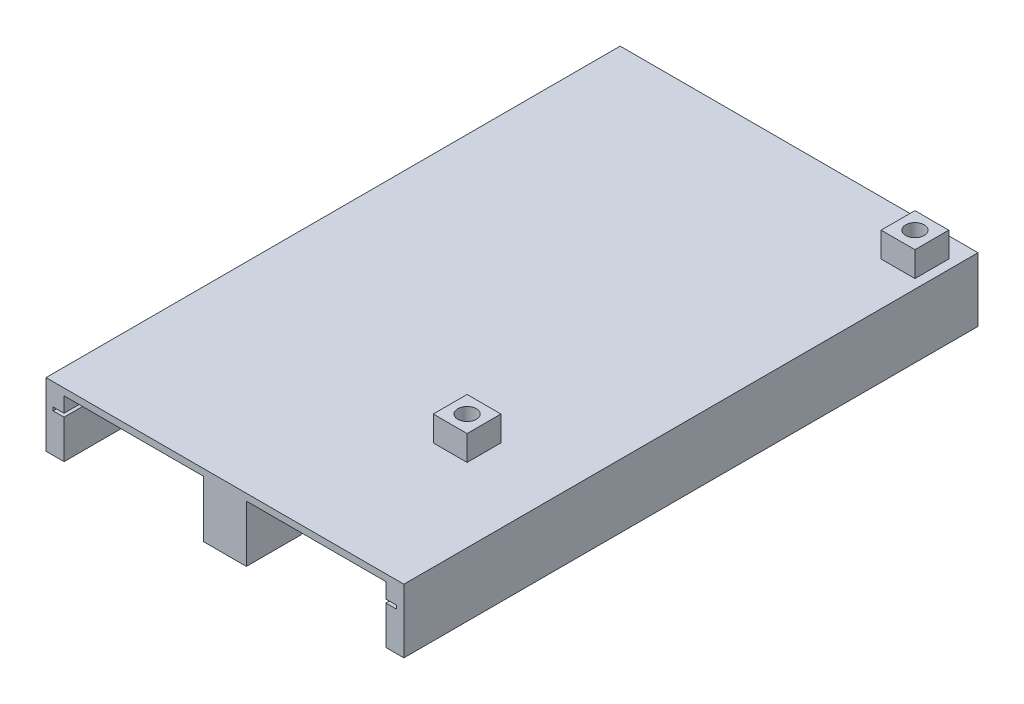
from build123d import *

# Parameters (mm, degrees)
SKETCH_1_W          = 4
SKETCH_1_H          = 127.3
EXTRUDE_1_DEPTH     = 12.65
EXTRUDE_1_2_DEPTH   = 12.65
SKETCH_2_W          = 79.35
SKETCH_2_H          = 127.3
EXTRUDE_2_DEPTH     = 1.5
CUT_EXTRUDE_START   = -1.5
SKETCH_3_W          = 2.4
SKETCH_3_H          = 0.75
CUT_EXTRUDE_1_DEPTH = 133.588098372
SKETCH_4_W          = 71.35
SKETCH_4_H          = 1.5
EXTRUDE_3_DEPTH     = 12.65
SKETCH_6_W          = 7.5
SKETCH_6_H          = 9.8
EXTRUDE_5_DEPTH     = 9.6
SKETCH_7_R          = 2.05
CUT_EXTRUDE_2_DEPTH = 4.5
SKETCH_8_W          = 2.4
SKETCH_8_H          = 5.85
CUT_EXTRUDE_3_DEPTH = 8.55
SKETCH_10_W         = 3
SKETCH_10_H         = 5.95
EXTRUDE_6_DEPTH     = 3.95
SKETCH_11_W         = 40.5
SKETCH_11_H         = 5.95
EXTRUDE_7_DEPTH     = 0.35
FILLET_4_R          = 4
FILLET_5_R          = 2
SKETCH_12_W         = 41
SKETCH_12_H         = 4.65
CUT_EXTRUDE_4_DEPTH = 133.664871481
EXTRUDE_8_DEPTH     = 12.55
SKETCH_14_R         = 2.05
CUT_EXTRUDE_5_DEPTH = 7
SKETCH_15_W         = 7.5
SKETCH_15_H         = 7.5
EXTRUDE_9_DEPTH     = 5.55
SKETCH_16_R         = 2.05
CUT_EXTRUDE_6_DEPTH = 5


with BuildPart() as part:
    # Эскиз1 → Бобышка-Вытянуть1 (new body)
    with BuildSketch(Plane(origin=(0, 0, 0), x_dir=(1, 0, 0), z_dir=(0, 1, 0))):
        with Locations((37.675, 0)):
            Rectangle(SKETCH_1_W, SKETCH_1_H)
    extrude(amount=EXTRUDE_1_DEPTH)



with BuildPart() as body_2:
    # Эскиз1 → Extrude 1 2 (new body)
    with BuildSketch(Plane(origin=(0, 0, 0), x_dir=(1, 0, 0), z_dir=(0, 1, 0))):
        with Locations((-37.675, 0)):
            Rectangle(SKETCH_1_W, SKETCH_1_H)
    extrude(amount=EXTRUDE_1_2_DEPTH)


with BuildPart() as part_1:
    add(part.part)

    add(body_2.part)  # Бобышка-Вытянуть2 merges body 2
    # Эскиз2 → Бобышка-Вытянуть2 (add)
    with BuildSketch(Plane(origin=(0, 12.65, 0), x_dir=(1, 0, 0), z_dir=(0, 1, 0))):
        Rectangle(SKETCH_2_W, SKETCH_2_H)
    extrude(amount=EXTRUDE_2_DEPTH)

    # Эскиз3 → Вырез-Вытянуть1 (cut, through all)
    with BuildSketch(Plane(origin=(0, 0, -63.65), x_dir=(-1, 0, 0), z_dir=(0, 0, -1)).offset(CUT_EXTRUDE_START)):
        with Locations((-36.875, 8.925)):
            Rectangle(SKETCH_3_W, SKETCH_3_H)
        with Locations((36.875, 8.925)):
            Rectangle(SKETCH_3_W, SKETCH_3_H)
    extrude(amount=-CUT_EXTRUDE_1_DEPTH, mode=Mode.SUBTRACT)

    # Эскиз4 → Бобышка-Вытянуть3 (add)
    with BuildSketch(Plane.XZ.offset(-12.65)):
        with Locations((0, -62.9)):
            Rectangle(SKETCH_4_W, SKETCH_4_H)
    extrude(amount=EXTRUDE_3_DEPTH)

    # Эскиз6 → Бобышка-Вытянуть5 (add)
    with BuildSketch(Plane.XZ.offset(-12.65)):
        with Locations((28.575, -57.25)):
            Rectangle(SKETCH_6_W, SKETCH_6_H)
    extrude(amount=EXTRUDE_5_DEPTH)

    # Эскиз7 → Вырез-Вытянуть2 (cut)
    with BuildSketch(Plane.XZ.offset(-3.05)):
        with Locations(Location((28.575, -56.1, 0), (0, 0, 270))):
            Circle(SKETCH_7_R)
    extrude(amount=-CUT_EXTRUDE_2_DEPTH, mode=Mode.SUBTRACT)

    # Эскиз8 → Вырез-Вытянуть3 (cut)
    with BuildSketch(Plane.XZ):
        with Locations((-36.875, 35.125)):
            Rectangle(SKETCH_8_W, SKETCH_8_H)
        with Locations((-36.875, -19.475)):
            Rectangle(SKETCH_8_W, SKETCH_8_H)
        with Locations((36.875, -19.475)):
            Rectangle(SKETCH_8_W, SKETCH_8_H)
        with Locations((36.875, 35.125)):
            Rectangle(SKETCH_8_W, SKETCH_8_H)
    extrude(amount=-CUT_EXTRUDE_3_DEPTH, mode=Mode.SUBTRACT)

    # Эскиз10 → Бобышка-Вытянуть6 (add)
    with BuildSketch(Plane.XZ.offset(-12.65)):
        with Locations((-26.775, -54.725)):
            Rectangle(SKETCH_10_W, SKETCH_10_H)
        with Locations((16.725, -54.725)):
            Rectangle(SKETCH_10_W, SKETCH_10_H)
    extrude(amount=EXTRUDE_6_DEPTH)

    # Эскиз11 → Бобышка-Вытянуть7 (add)
    with BuildSketch(Plane.XZ.offset(-12.65)):
        with Locations((-5.025, -54.725)):
            Rectangle(SKETCH_11_W, SKETCH_11_H)
    extrude(amount=EXTRUDE_7_DEPTH)

    # Скругление4
    # the kernel refuses this fillet: 4 mm, written as the material it adds along each edge
    with BuildSketch(Plane(origin=(18.225, 12.65, -57.7), x_dir=(0, 0, -1), z_dir=(-1, 0, 0))) as fillet_4_piece_1_section:
        with BuildLine():
            CenterArc((FILLET_4_R, FILLET_4_R), FILLET_4_R, 180, 90)
            Line((0, FILLET_4_R), (0, 0))
            Line((0, 0), (FILLET_4_R, 0))
        make_face()
    fillet_4_piece_1 = extrude(amount=46.5, mode=Mode.PRIVATE)
    fillet_4_piece_1 = split(fillet_4_piece_1, bisect_by=Plane(origin=(15.225, 12.535953676, -59.259664423), z_dir=(1, 0, 0)), keep=Keep.TOP, mode=Mode.PRIVATE)
    fillet_4_piece_1 = split(fillet_4_piece_1, bisect_by=Plane(origin=(16.725, 12.3, -59.259664423), z_dir=(0, 1, 0)), keep=Keep.TOP, mode=Mode.PRIVATE)
    add(fillet_4_piece_1)
    with BuildSketch(Plane(origin=(18.225, 12.65, -57.7), x_dir=(0, 0, -1), z_dir=(-1, 0, 0))) as fillet_4_piece_2_section:
        with BuildLine():
            CenterArc((FILLET_4_R, FILLET_4_R), FILLET_4_R, 180, 90)
            Line((0, FILLET_4_R), (0, 0))
            Line((0, 0), (FILLET_4_R, 0))
        make_face()
    fillet_4_piece_2 = extrude(amount=46.5, mode=Mode.PRIVATE)
    fillet_4_piece_2 = split(fillet_4_piece_2, bisect_by=Plane(origin=(16.725, 8.7, -58.276150153), z_dir=(0, 1, 0)), keep=Keep.TOP, mode=Mode.PRIVATE)
    fillet_4_piece_2 = split(fillet_4_piece_2, bisect_by=Plane(origin=(15.225, 11.348610823, -58.276150153), z_dir=(1, 0, 0)), keep=Keep.TOP, mode=Mode.PRIVATE)
    fillet_4_piece_2 = split(fillet_4_piece_2, bisect_by=Plane(origin=(16.725, 12.3, -58.276150153), z_dir=(0, -1, 0)), keep=Keep.TOP, mode=Mode.PRIVATE)
    add(fillet_4_piece_2)
    with BuildSketch(Plane(origin=(18.225, 12.65, -57.7), x_dir=(0, 0, -1), z_dir=(-1, 0, 0))) as fillet_4_piece_3_section:
        with BuildLine():
            CenterArc((FILLET_4_R, FILLET_4_R), FILLET_4_R, 180, 90)
            Line((0, FILLET_4_R), (0, 0))
            Line((0, 0), (FILLET_4_R, 0))
        make_face()
    fillet_4_piece_3 = extrude(amount=46.5, mode=Mode.PRIVATE)
    fillet_4_piece_3 = split(fillet_4_piece_3, bisect_by=Plane(origin=(15.225, 12.535953676, -59.259664423), z_dir=(-1, 0, 0)), keep=Keep.TOP, mode=Mode.PRIVATE)
    fillet_4_piece_3 = split(fillet_4_piece_3, bisect_by=Plane(origin=(-5.025, 12.3, -59.259664423), z_dir=(0, 1, 0)), keep=Keep.TOP, mode=Mode.PRIVATE)
    fillet_4_piece_3 = split(fillet_4_piece_3, bisect_by=Plane(origin=(-25.275, 12.535953676, -59.259664423), z_dir=(1, 0, 0)), keep=Keep.TOP, mode=Mode.PRIVATE)
    add(fillet_4_piece_3)
    with BuildSketch(Plane(origin=(18.225, 12.65, -57.7), x_dir=(0, 0, -1), z_dir=(-1, 0, 0))) as fillet_4_piece_4_section:
        with BuildLine():
            CenterArc((FILLET_4_R, FILLET_4_R), FILLET_4_R, 180, 90)
            Line((0, FILLET_4_R), (0, 0))
            Line((0, 0), (FILLET_4_R, 0))
        make_face()
    fillet_4_piece_4 = extrude(amount=46.5, mode=Mode.PRIVATE)
    fillet_4_piece_4 = split(fillet_4_piece_4, bisect_by=Plane(origin=(-26.775, 12.3, -59.259664423), z_dir=(0, 1, 0)), keep=Keep.TOP, mode=Mode.PRIVATE)
    fillet_4_piece_4 = split(fillet_4_piece_4, bisect_by=Plane(origin=(-25.275, 12.535953676, -59.259664423), z_dir=(-1, 0, 0)), keep=Keep.TOP, mode=Mode.PRIVATE)
    add(fillet_4_piece_4)
    with BuildSketch(Plane(origin=(18.225, 12.65, -57.7), x_dir=(0, 0, -1), z_dir=(-1, 0, 0))) as fillet_4_piece_5_section:
        with BuildLine():
            CenterArc((FILLET_4_R, FILLET_4_R), FILLET_4_R, 180, 90)
            Line((0, FILLET_4_R), (0, 0))
            Line((0, 0), (FILLET_4_R, 0))
        make_face()
    fillet_4_piece_5 = extrude(amount=46.5, mode=Mode.PRIVATE)
    fillet_4_piece_5 = split(fillet_4_piece_5, bisect_by=Plane(origin=(-26.775, 8.7, -58.276150153), z_dir=(0, 1, 0)), keep=Keep.TOP, mode=Mode.PRIVATE)
    fillet_4_piece_5 = split(fillet_4_piece_5, bisect_by=Plane(origin=(-26.775, 12.3, -58.276150153), z_dir=(0, -1, 0)), keep=Keep.TOP, mode=Mode.PRIVATE)
    fillet_4_piece_5 = split(fillet_4_piece_5, bisect_by=Plane(origin=(-25.275, 11.348610823, -58.276150153), z_dir=(-1, 0, 0)), keep=Keep.TOP, mode=Mode.PRIVATE)
    add(fillet_4_piece_5)

    # Скругление5
    fillet_5_edges = [part_1.edges().sort_by_distance(p)[0] for p in [
        (-26.775, 8.7, -57.700312512),
        (16.725, 8.7, -57.700312512),
    ]]
    fillet(fillet_5_edges, radius=FILLET_5_R)

    # Эскиз12 → Вырез-Вытянуть4 (cut, through all)
    with BuildSketch(Plane.XY.offset(-62.15)):
        with Locations((-5.025, 10.325)):
            Rectangle(SKETCH_12_W, SKETCH_12_H)
    extrude(amount=-CUT_EXTRUDE_4_DEPTH, mode=Mode.SUBTRACT)

    # Эскиз13 → Бобышка-Вытянуть8 (add)
    with BuildSketch(Plane.XZ.offset(-12.65)):
        Polygon((-4.75, 60.9), (-4.75, 63.65), (4.75, 63.65), (4.75, 60.9), (4.75, 51.4), (-4.75, 51.4), align=None)
    extrude(amount=EXTRUDE_8_DEPTH)

    # Эскиз14 → Вырез-Вытянуть5 (cut)
    with BuildSketch(Plane.XZ.offset(-0.1)):
        with Locations(Location((0, 56.15, 0), (0, 0, 270))):
            Circle(SKETCH_14_R)
    extrude(amount=-CUT_EXTRUDE_5_DEPTH, mode=Mode.SUBTRACT)

    # Эскиз15 → Бобышка-Вытянуть9 (add)
    with BuildSketch(Plane(origin=(0, 14.15, 0), x_dir=(1, 0, 0), z_dir=(0, 1, 0))):
        with Locations((33.89536, 55.44709)):
            Rectangle(SKETCH_15_W, SKETCH_15_H)
        with Locations((19.55046, -29.51121)):
            Rectangle(SKETCH_15_W, SKETCH_15_H)
    extrude(amount=EXTRUDE_9_DEPTH)

    # Эскиз16 → Вырез-Вытянуть6 (cut)
    with BuildSketch(Plane(origin=(0, 19.7, 0), x_dir=(1, 0, 0), z_dir=(0, 1, 0))):
        with Locations(Location((19.55046, -29.51121, 0), (0, 0, 270))):
            Circle(SKETCH_16_R)
        with Locations(Location((33.89536, 55.44709, 0), (0, 0, 270))):
            Circle(SKETCH_16_R)
    extrude(amount=-CUT_EXTRUDE_6_DEPTH, mode=Mode.SUBTRACT)


solid = part_1.part
